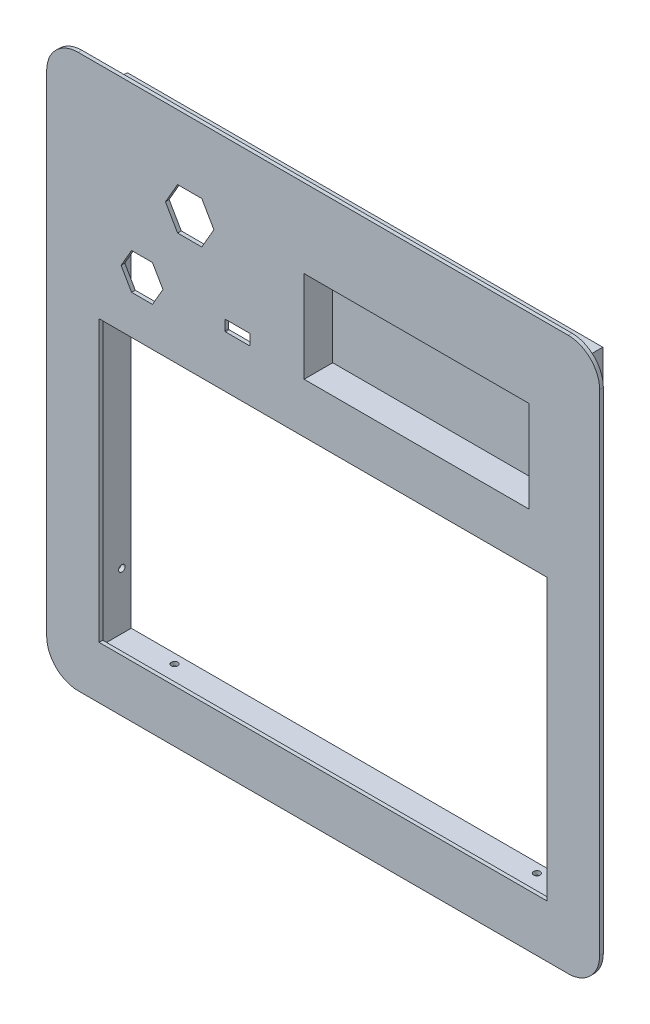
from build123d import *

# Parameters (mm, degrees)
SKETCH3_W           = 235
SKETCH3_H           = 147
BOSS_EXTRUDE1_DEPTH = 2
BOSS_EXTRUDE1_DRAFT = -2
SKETCH4_W           = 249.3
SKETCH4_H           = 253.3
BOSS_EXTRUDE2_DEPTH = 20
BOSS_EXTRUDE2_DRAFT = 2
SKETCH5_W           = 245.3
SKETCH5_H           = 249.3
CUT_EXTRUDE1_DEPTH  = 20
SKETCH3_3_W         = 122
SKETCH3_3_H         = 52
BOSS_EXTRUDE3_DEPTH = 17
SKETCH6_W           = 118
SKETCH6_H           = 48
CUT_EXTRUDE2_DEPTH  = 15
FILLET1_R           = 2
CUT_EXTRUDE7_START  = -3
SKETCH11_R          = 1.7
CUT_EXTRUDE7_DEPTH  = 312.966640875
SKETCH12_R          = 1.7
CUT_EXTRUDE8_DEPTH  = 3


with BuildPart() as part:
    # Sketch3 → Boss-Extrude1 (with draft: the straight prism first)
    with BuildSketch(Plane.XY):
        with BuildLine():
            ThreePointArc((-145, -128.49), (-140.164332957, -140.164332957), (-128.49, -145))
            Line((-128.49, -145), (128.49, -145))
            ThreePointArc((128.49, -145), (140.164332957, -140.164332957), (145, -128.49))
            Line((145, -128.49), (145, 128.49))
            ThreePointArc((145, 128.49), (140.164332957, 140.164332957), (128.49, 145))
            Line((128.49, 145), (-128.49, 145))
            ThreePointArc((-128.49, 145), (-140.164332957, 140.164332957), (-145, 128.49))
            Line((-145, 128.49), (-145, -128.49))
        make_face()
        with Locations((0, -44)):
            Rectangle(SKETCH3_W, SKETCH3_H, mode=Mode.SUBTRACT)
        Polygon((-89.515172443, 69), (-84.030344885, 59.5), (-89.515172443, 50), (-100.484827557, 50), (-105.969655115, 59.5), (-100.484827557, 69), align=None, mode=Mode.SUBTRACT)
        with BuildLine():
            Line((-51.23, 62.35), (-38.77, 62.35))
            ThreePointArc((-38.77, 62.35), (-38.550796898, 62.259203102), (-38.46, 62.04))
            Line((-38.46, 62.04), (-38.46, 56.96))
            ThreePointArc((-38.46, 56.96), (-38.550796898, 56.740796898), (-38.77, 56.65))
            Line((-38.77, 56.65), (-51.23, 56.65))
            ThreePointArc((-51.23, 56.65), (-51.449203102, 56.740796898), (-51.54, 56.96))
            Line((-51.54, 56.96), (-51.54, 62.04))
            ThreePointArc((-51.54, 62.04), (-51.449203102, 62.259203102), (-51.23, 62.35))
        make_face(mode=Mode.SUBTRACT)
        Polygon((-63.649147039, 111), (-57.298294078, 100), (-63.649147039, 89), (-76.350852961, 89), (-82.701705922, 100), (-76.350852961, 111), align=None, mode=Mode.SUBTRACT)
    extrude(amount=-BOSS_EXTRUDE1_DEPTH)
    # Boss-Extrude1: the draft: its side faces are tilted about the plane it starts from
    boss_extrude1_sides = [part.faces().sort_by_distance(p)[0] for p in [
        (-140.164332957, -140.164332957, -1),
        (0, -145, -1),
        (140.164332957, -140.164332957, -1),
        (145, 0, -1),
        (140.164332957, 140.164332957, -1),
        (0, 145, -1),
        (-140.164332957, 140.164332957, -1),
        (-145, 0, -1),
        (0, -117.5, -1),
        (-117.5, -44, -1),
        (0, 29.5, -1),
        (117.5, -44, -1),
        (-86.772758664, 64.25, -1),
        (-86.772758664, 54.75, -1),
        (-95, 50, -1),
        (-103.227241336, 54.75, -1),
        (-103.227241336, 64.25, -1),
        (-95, 69, -1),
        (-45, 62.35, -1),
        (-38.550796898, 62.259203102, -1),
        (-38.46, 59.5, -1),
        (-38.550796898, 56.740796898, -1),
        (-45, 56.65, -1),
        (-51.449203102, 56.740796898, -1),
        (-51.54, 59.5, -1),
        (-51.449203102, 62.259203102, -1),
        (-60.473720558, 105.5, -1),
        (-60.473720558, 94.5, -1),
        (-70, 89, -1),
        (-79.526279442, 94.5, -1),
        (-79.526279442, 105.5, -1),
        (-70, 111, -1),
    ]]
    draft(boss_extrude1_sides, Plane.XY, BOSS_EXTRUDE1_DRAFT)


with BuildPart() as boss_extrude2_tool:
    # Sketch4 → Boss-Extrude2 (with draft: the straight prism first)
    with BuildSketch(Plane(origin=(0, 0, -22), x_dir=(-1, 0, 0), z_dir=(0, 0, -1))):
        Rectangle(SKETCH4_W, SKETCH4_H)
    extrude(amount=-BOSS_EXTRUDE2_DEPTH)
    # Boss-Extrude2: the draft: its side faces are tilted about the plane it starts from
    boss_extrude2_sides = [boss_extrude2_tool.faces().sort_by_distance(p)[0] for p in [
        (0, -126.65, -12),
        (-124.65, 0, -12),
        (0, 126.65, -12),
        (124.65, 0, -12),
    ]]
    draft(boss_extrude2_sides, Plane(origin=(0, 0, -22), x_dir=(-1, 0, 0), z_dir=(0, 0, -1)), BOSS_EXTRUDE2_DRAFT)


with BuildPart() as part_1:
    add(part.part)

    # Boss-Extrude2: add boss_extrude2_tool
    add(boss_extrude2_tool.part)

    # Sketch5 → Cut-Extrude1 (cut)
    with BuildSketch(Plane(origin=(0, 0, -22), x_dir=(-1, 0, 0), z_dir=(0, 0, -1))):
        Rectangle(SKETCH5_W, SKETCH5_H)
    extrude(amount=-CUT_EXTRUDE1_DEPTH, mode=Mode.SUBTRACT)

    # Sketch3<3> → Boss-Extrude3 (add)
    with BuildSketch(Plane.XY):
        with Locations((49, 79.75)):
            Rectangle(SKETCH3_3_W, SKETCH3_3_H)
    extrude(amount=-BOSS_EXTRUDE3_DEPTH)

    # Sketch6 → Cut-Extrude2 (cut)
    with BuildSketch(Plane.XY):
        with Locations((49, 79.75)):
            Rectangle(SKETCH6_W, SKETCH6_H)
    extrude(amount=-CUT_EXTRUDE2_DEPTH, mode=Mode.SUBTRACT)

    # Fillet1
    fillet1_edges = [part_1.edges().sort_by_distance(p)[0] for p in [
        (49, 105.75, -17),
        (49, 105.75, -2),
        (-12, 79.75, -17),
        (-12, 105.75, -9.5),
        (-12, 79.75, -2),
        (49, 53.75, -17),
        (-12, 53.75, -9.5),
        (49, 53.75, -2),
        (110, 105.75, -9.5),
        (110, 79.75, -17),
        (110, 53.75, -9.5),
        (110, 79.75, -2),
        (0, -124.65, -2),
        (-122.65, 0, -2),
        (122.65, 0, -2),
        (0, 124.65, -2),
    ]]
    fillet(fillet1_edges, radius=FILLET1_R)

    # Sketch11 → Cut-Extrude7 (cut)
    with BuildSketch(Plane(origin=(0, -127.263064694, -4.444124147), x_dir=(1, 0, 0), z_dir=(0, -0.9993908270190958, -0.034899496702501046)).offset(CUT_EXTRUDE7_START)):
        with Locations((-95, -12.718358383)):
            Circle(SKETCH11_R)
        with Locations((95, -12.718358383)):
            Circle(SKETCH11_R)
    cut_extrude7 = extrude(amount=CUT_EXTRUDE7_DEPTH, mode=Mode.SUBTRACT)

    # Mirror1: Cut-Extrude7 across plane
    add(cut_extrude7.mirror(Plane.ZX), mode=Mode.SUBTRACT)

    # Sketch12 → Cut-Extrude8 (cut)
    with BuildSketch(Plane(origin=(125.265500644, 0, -4.374367673), x_dir=(-0.034899496702501046, 0, -0.9993908270190958), z_dir=(0.9993908270190958, 0, -0.034899496702501046))):
        with Locations((12.786939031, 95)):
            Circle(SKETCH12_R)
        with Locations((12.786939031, -95)):
            Circle(SKETCH12_R)
    cut_extrude8 = extrude(amount=-CUT_EXTRUDE8_DEPTH, mode=Mode.SUBTRACT)

    # Mirror2: Cut-Extrude8 across plane
    add(cut_extrude8.mirror(Plane(origin=(0, 0, 0), x_dir=(0, 0, 1), z_dir=(1, 0, 0))), mode=Mode.SUBTRACT)


solid = part_1.part
